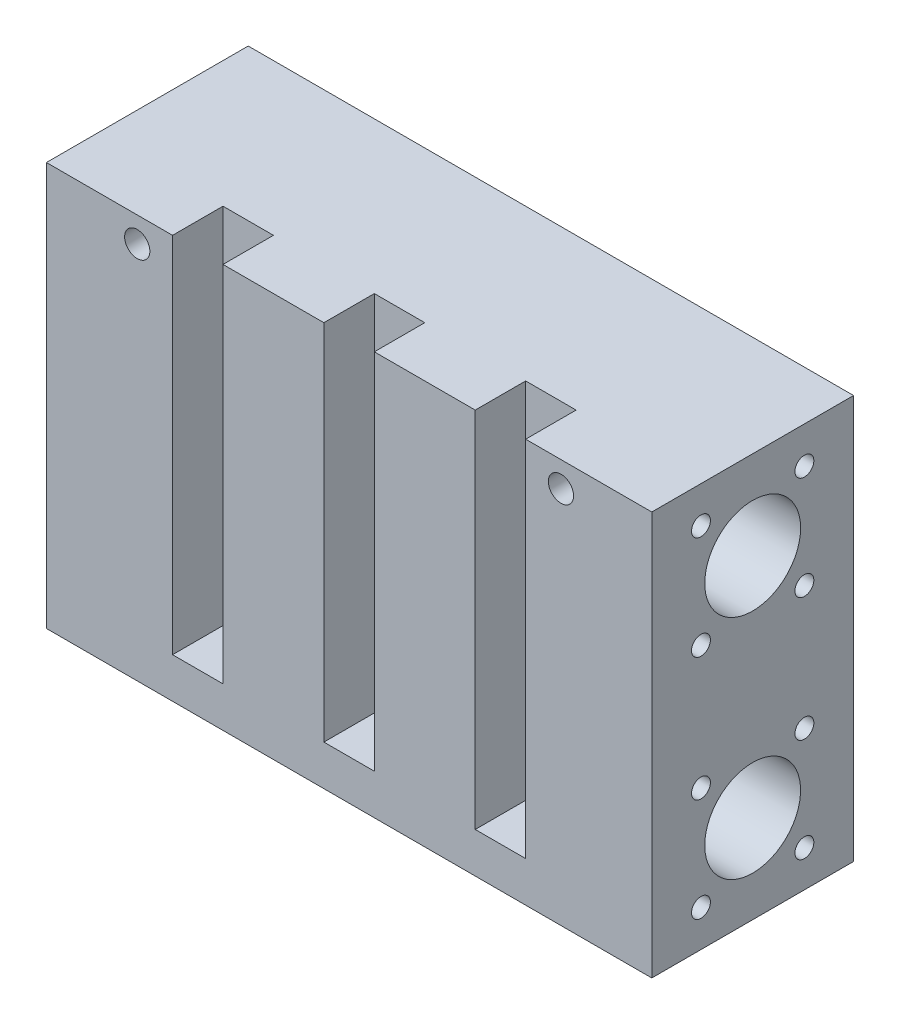
from build123d import *

# Parameters (mm, degrees)
SKETCH1_W                        = 120
SKETCH1_H                        = 80
BOSS_EXTRUDE1_DEPTH              = 40
SKETCH2_R                        = 1.85
LINEAR_BEARING_SCREW_CUTS_DEPTH  = 14
SKETCH3_R                        = 9.5
LINEAR_BEARINGS_HOLE_DEPTH       = 55
SKETCH4_R                        = 1.875
LINEAR_BEARING_SCREW_CUTS2_DEPTH = 14
LINEAR_BEARINGS_HOLE2_START      = -55
SKETCH5_R                        = 9.5
LINEAR_BEARINGS_HOLE2_DEPTH      = 55
SKETCH10_W                       = 10
SKETCH10_H                       = 10
CUT_EXTRUDE7_DEPTH               = 72
SKETCH12_R                       = 6
CUT_EXTRUDE9_DEPTH               = 111.566721937
SKETCH13_R                       = 2.5
CUT_EXTRUDE10_DEPTH              = 150.666295471


with BuildPart() as part:
    # Sketch1 → Boss-Extrude1 (new body)
    with BuildSketch(Plane.XY):
        with Locations((60, 40)):
            Rectangle(SKETCH1_W, SKETCH1_H)
    extrude(amount=BOSS_EXTRUDE1_DEPTH)

    # Sketch2 → linear-bearing-screw-cuts (cut)
    with BuildSketch(Plane.ZY):
        with Locations((30.25, 72.75)):
            Circle(SKETCH2_R)
        with Locations((9.75, 72.75)):
            Circle(SKETCH2_R)
        with Locations((30.25, 52.25)):
            Circle(SKETCH2_R)
        with Locations((9.75, 52.25)):
            Circle(SKETCH2_R)
        with Locations((9.75, 27.75)):
            Circle(SKETCH2_R)
        with Locations((30.25, 27.75)):
            Circle(SKETCH2_R)
        with Locations((30.25, 7.25)):
            Circle(SKETCH2_R)
        with Locations((9.75, 7.25)):
            Circle(SKETCH2_R)
    extrude(amount=-LINEAR_BEARING_SCREW_CUTS_DEPTH, mode=Mode.SUBTRACT)

    # Sketch3 → linear-bearings-hole (cut)
    with BuildSketch(Plane.ZY):
        with Locations((20, 62.5)):
            Circle(SKETCH3_R)
        with Locations((20, 17.5)):
            Circle(SKETCH3_R)
    extrude(amount=-LINEAR_BEARINGS_HOLE_DEPTH, mode=Mode.SUBTRACT)

    # Sketch4 → linear-bearing-screw-cuts2 (cut)
    with BuildSketch(Plane(origin=(120, 0, 0), x_dir=(0, 0, -1), z_dir=(1, 0, 0))):
        with Locations((-9.75, 72.75)):
            Circle(SKETCH4_R)
        with Locations((-30.25, 72.75)):
            Circle(SKETCH4_R)
        with Locations((-9.75, 52.25)):
            Circle(SKETCH4_R)
        with Locations((-30.25, 52.25)):
            Circle(SKETCH4_R)
        with Locations((-30.25, 27.75)):
            Circle(SKETCH4_R)
        with Locations((-9.75, 27.75)):
            Circle(SKETCH4_R)
        with Locations((-9.75, 7.25)):
            Circle(SKETCH4_R)
        with Locations((-30.25, 7.25)):
            Circle(SKETCH4_R)
    extrude(amount=-LINEAR_BEARING_SCREW_CUTS2_DEPTH, mode=Mode.SUBTRACT)

    # Sketch5 → linear-bearings-hole2 (cut)
    with BuildSketch(Plane(origin=(120, 0, 0), x_dir=(0, 0, -1), z_dir=(1, 0, 0)).offset(LINEAR_BEARINGS_HOLE2_START)):
        with Locations((-20, 62.5)):
            Circle(SKETCH5_R)
        with Locations((-20, 17.5)):
            Circle(SKETCH5_R)
    extrude(amount=LINEAR_BEARINGS_HOLE2_DEPTH, mode=Mode.SUBTRACT)

    # Sketch10 → Cut-Extrude7 (cut)
    with BuildSketch(Plane(origin=(0, 80, 0), x_dir=(1, 0, 0), z_dir=(0, 1, 0))):
        with Locations((90, -35)):
            Rectangle(SKETCH10_W, SKETCH10_H)
        with Locations((60, -35)):
            Rectangle(SKETCH10_W, SKETCH10_H)
        with Locations((30, -35)):
            Rectangle(SKETCH10_W, SKETCH10_H)
    extrude(amount=-CUT_EXTRUDE7_DEPTH, mode=Mode.SUBTRACT)

    # Sketch12 → Cut-Extrude9 (cut, through all)
    with BuildSketch(Plane(origin=(65, 0, 0), x_dir=(0, 0, -1), z_dir=(1, 0, 0))):
        with Locations((-20, 62.5)):
            Circle(SKETCH12_R)
        with Locations((-20, 17.5)):
            Circle(SKETCH12_R)
    extrude(amount=-CUT_EXTRUDE9_DEPTH, mode=Mode.SUBTRACT)

    # Sketch13 → Cut-Extrude10 (cut, through all)
    with BuildSketch(Plane(origin=(0, 0, 0), x_dir=(-1, 0, 0), z_dir=(0, 0, -1))):
        with Locations((-102, 75)):
            Circle(SKETCH13_R)
        with Locations((-18, 75)):
            Circle(SKETCH13_R)
    extrude(amount=-CUT_EXTRUDE10_DEPTH, mode=Mode.SUBTRACT)


solid = part.part
